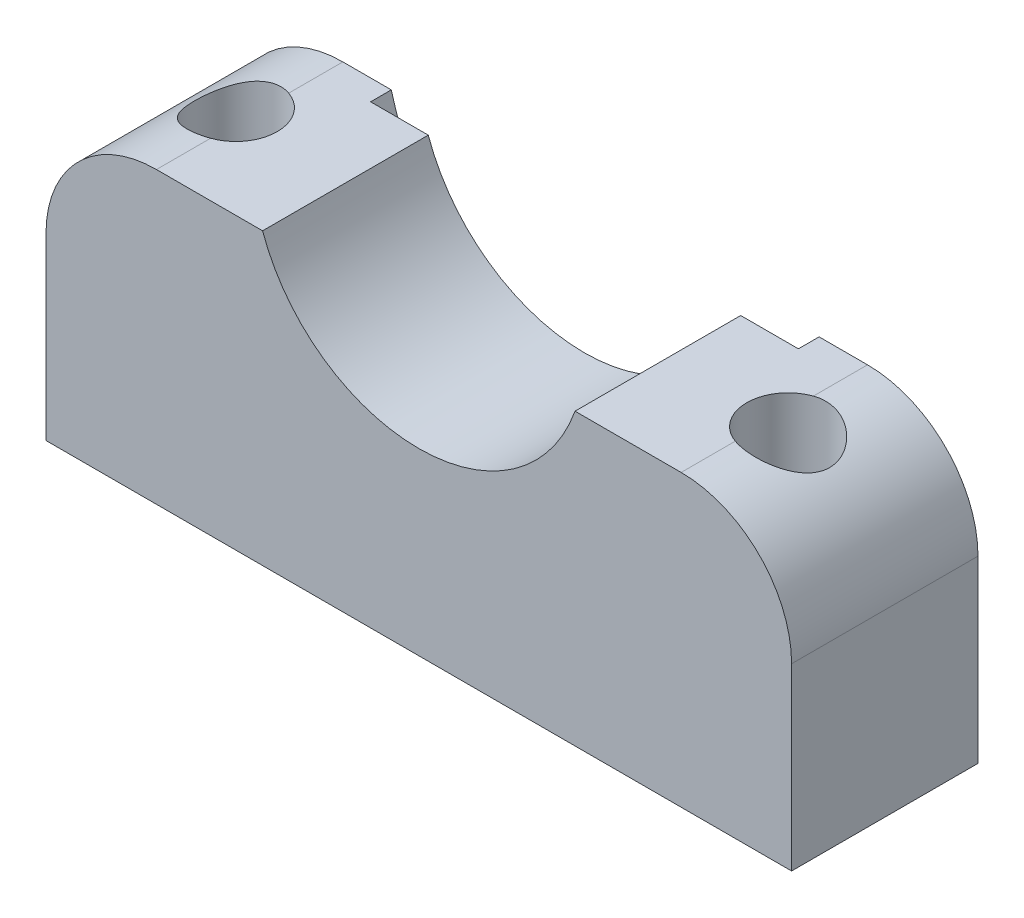
from build123d import *

# Parameters (mm, degrees)
BOSS_EXTRUDE1_DEPTH = 6.75
SKETCH3_R           = 8
CUT_EXTRUDE2_DEPTH  = 0.75
SKETCH4_W           = 27
SKETCH4_H           = 2
CUT_EXTRUDE3_DEPTH  = 9
SKETCH5_R           = 1.5
CUT_EXTRUDE4_DEPTH  = 16
FILLET1_R           = 4


with BuildPart() as part:
    # Sketch1 → Boss-Extrude1 (new body)
    with BuildSketch(Plane.XY):
        with BuildLine():
            Line((-27, 0), (0, 0))
            Line((0, 0), (0, 12.5))
            Line((0, 12.5), (-7.5, 12.5))
            ThreePointArc((-7.5, 12.5), (-13.5, 6.5), (-19.5, 12.5))
            Line((-19.5, 12.5), (-27, 12.5))
            Line((-27, 12.5), (-27, 0))
        make_face()
    extrude(amount=BOSS_EXTRUDE1_DEPTH)

    # Sketch3 → Cut-Extrude2 (cut)
    with BuildSketch(Plane(origin=(0, 0, 0), x_dir=(-1, 0, 0), z_dir=(0, 0, -1))):
        with Locations((13.5, 12.5)):
            Circle(SKETCH3_R)
    extrude(amount=-CUT_EXTRUDE2_DEPTH, mode=Mode.SUBTRACT)

    # Sketch4 → Cut-Extrude3 (cut)
    with BuildSketch(Plane.XY.offset(6.75)):
        with Locations((-13.5, 11.5)):
            Rectangle(SKETCH4_W, SKETCH4_H)
    extrude(amount=-CUT_EXTRUDE3_DEPTH, mode=Mode.SUBTRACT)

    # Sketch5 → Cut-Extrude4 (cut)
    with BuildSketch(Plane.XZ):
        with Locations((-23.5, 3.375)):
            Circle(SKETCH5_R)
        with Locations((-3.5, 3.375)):
            Circle(SKETCH5_R)
    extrude(amount=-CUT_EXTRUDE4_DEPTH, mode=Mode.SUBTRACT)

    # Fillet1
    # the kernel refuses this fillet: 4 mm, written as the material it takes off along each edge
    with BuildSketch(Plane(origin=(-27, 10.5, 16.75), x_dir=(1, 0, 0), z_dir=(0, 0, -1))) as fillet1_piece_1:
        with BuildLine():
            CenterArc((FILLET1_R, FILLET1_R), FILLET1_R, 180, 90)
            Line((0, FILLET1_R), (0, 0))
            Line((0, 0), (FILLET1_R, 0))
        make_face()
    extrude(amount=26.75, mode=Mode.SUBTRACT)
    with BuildSketch(Plane(origin=(0, 10.5, 16.75), x_dir=(-1, 0, 0), z_dir=(0, 0, -1))) as fillet1_piece_2:
        with BuildLine():
            CenterArc((FILLET1_R, -FILLET1_R), FILLET1_R, 90, 90)
            Line((0, -FILLET1_R), (0, 0))
            Line((0, 0), (FILLET1_R, 0))
        make_face()
    extrude(amount=26.75, mode=Mode.SUBTRACT)


solid = part.part
